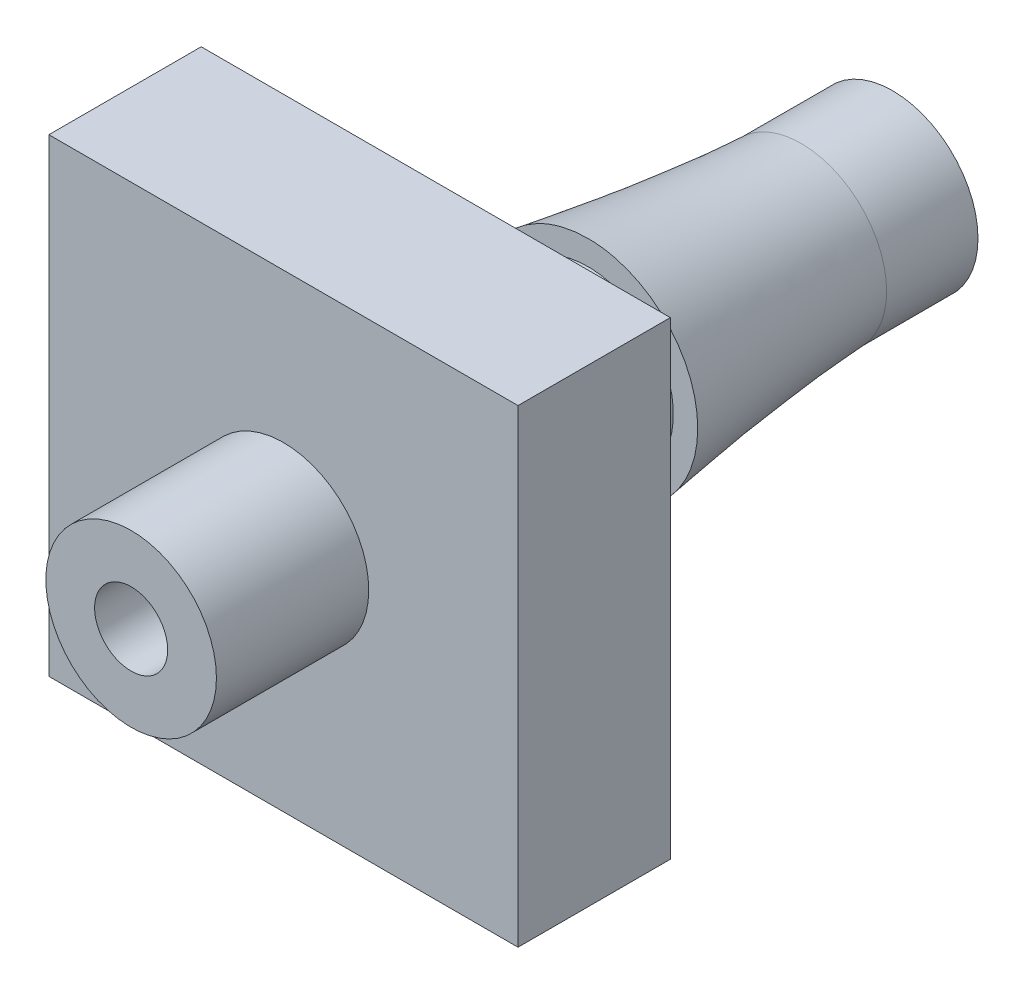
from build123d import *

# Parameters (mm, degrees)
CROQUIS1_W              = 7.7
CROQUIS1_H              = 7.7
SALIENTE_EXTRUIR1_DEPTH = 2.5
CROQUIS2_R              = 1.4
SALIENTE_EXTRUIR2_DEPTH = 7.5
SALIENTE_EXTRUIR3_START = 2.5
CROQUIS7_R              = 1.4
SALIENTE_EXTRUIR3_DEPTH = 2.5
CROQUIS6_R              = 0.6
CORTAR_EXTRUIR1_DEPTH   = 14.634331667


with BuildPart() as part:
    # Croquis1 → Saliente-Extruir1 (new body)
    with BuildSketch(Plane.XY):
        Rectangle(CROQUIS1_W, CROQUIS1_H)
    extrude(amount=SALIENTE_EXTRUIR1_DEPTH)

    # Croquis2 → Saliente-Extruir2 (add)
    with BuildSketch(Plane(origin=(0, 0, 0), x_dir=(-1, 0, 0), z_dir=(0, 0, -1))):
        Circle(CROQUIS2_R)
    extrude(amount=SALIENTE_EXTRUIR2_DEPTH)

    # Recubrir2: read off the stored shape, not the designer's step
    # Recubrir2: loft between two sections, ruled curve by curve
    recubrir2_from = [
        Edge.make_bspline([(-0.33839724, 1.767904779, -2.5), (3.197412318, 2.44469926, -2.5), (3.874206798, -1.091110298, -2.5), (0.33839724, -1.767904779, -2.5), (-3.197412318, -2.44469926, -2.5), (-3.874206798, 1.091110298, -2.5), (-0.33839724, 1.767904779, -2.5)], [0, 0, 0, 0, 0.5, 0.5, 0.5, 1, 1, 1, 1], 3, [1, 0.333333333, 0.333333333, 1, 0.333333333, 0.333333333, 1]),
    ]
    recubrir2_to = [
        Edge.make_bspline([(-0.867767345, 1.09862634, -6), (1.329485334, 2.83416103, -6), (3.065020025, 0.636908351, -6), (0.867767345, -1.09862634, -6), (-1.329485334, -2.83416103, -6), (-3.065020025, -0.636908351, -6), (-0.867767345, 1.09862634, -6)], [0, 0, 0, 0, 0.5, 0.5, 0.5, 1, 1, 1, 1], 3, [1, 0.333333333, 0.333333333, 1, 0.333333333, 0.333333333, 1]),
    ]
    recubrir2 = Solid(Shell([*[Face.make_surface_from_curves(recubrir2_from[k], recubrir2_to[k]) for k in range(1)], Face(Wire(recubrir2_from)), Face(Wire(recubrir2_to))]))
    add(recubrir2)

    # Croquis7 → Saliente-Extruir3 (add)
    with BuildSketch(Plane.XY.offset(2.5).offset(SALIENTE_EXTRUIR3_START)):
        with Locations(Location((0, 0, 0), (0, 0, 180))):
            Circle(CROQUIS7_R)
    extrude(amount=-SALIENTE_EXTRUIR3_DEPTH)

    # Croquis6 → Cortar-Extruir1 (cut, through all)
    with BuildSketch(Plane(origin=(0, 0, -7.5), x_dir=(-1, 0, 0), z_dir=(0, 0, -1))):
        Circle(CROQUIS6_R)
    extrude(amount=-CORTAR_EXTRUIR1_DEPTH, mode=Mode.SUBTRACT)


solid = part.part
